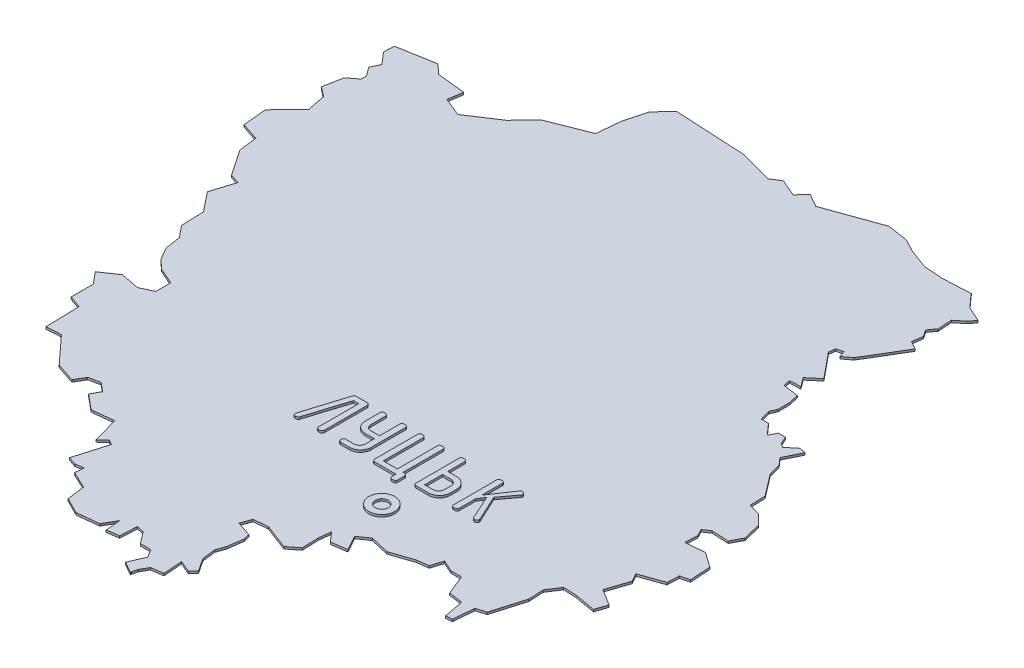
from build123d import *

# Parameters (mm, degrees)
EXTRUDE_1_DEPTH = 5
SKETCH_2_R      = 30
SKETCH_2_R_2    = 15
EXTRUDE_2_DEPTH = 10
SCALE_1_SCALE   = 0.05


with BuildPart() as part:
    # Эскиз1 → Бобышка-Вытянуть1 (new body)
    with BuildSketch(Plane(origin=(0, 0, 0), x_dir=(1, 0, 0), z_dir=(0, 1, 0))):
        Polygon((-8445.9445, 8921.74746), (-8480.32594, 8945.76316), (-8524.46352, 8941.86934), (-8523.14272, 8971.06918), (-8531.57806, 8986.65462), (-8516.00278, 8997.0229), (-8477.0976, 8995.07218), (-8463.45272, 9020.3909), (-8473.186, 9061.28744), (-8497.19916, 9085.29044), (-8523.14272, 9092.41768), (-8524.46352, 9128.125), (-8562.0733, 9177.43148), (-8570.53404, 9206.64148), (-8584.15352, 9222.19644), (-8565.3499, 9261.15242), (-8579.60438, 9264.40108), (-8601.66682, 9246.2223), (-8611.41534, 9252.70946), (-8618.55274, 9269.5776), (-8635.41834, 9269.5776), (-8643.85876, 9252.70946), (-8666.57652, 9278.01548), (-8683.43196, 9278.01548), (-8683.43196, 9278.65302), (-8689.92928, 9302.0261), (-8683.43196, 9316.97146), (-8683.43196, 9342.27748), (-8688.63896, 9366.92818), (-8724.32342, 9372.12502), (-8727.57208, 9387.68252), (-8702.26098, 9388.983), (-8717.8388, 9409.76274), (-8691.88254, 9431.82518), (-8739.91394, 9490.22232), (-8737.95814, 9505.13974), (-8722.3727, 9509.03102), (-8717.8388, 9494.75622), (-8699.0047, 9509.03102), (-8683.43196, 9534.36244), (-8645.80948, 9597.3011), (-8664.6258, 9607.677), (-8661.36444, 9631.68508), (-8671.76066, 9647.26544), (-8659.42134, 9664.12596), (-8661.36444, 9696.57446), (-8640.62026, 9713.4553), (-8630.21388, 9727.08748), (-8664.6258, 9742.66784), (-8683.43196, 9763.4425), (-8691.88254, 9773.16054), (-8756.75414, 9769.91442), (-8799.59124, 9773.16054), (-8845.6643, 9790.01852), (-8874.2266, 9805.60142), (-8922.24022, 9812.74644), (-9046.84754, 9767.96116), (-9077.34786, 9785.49732), (-9096.16672, 9764.73028), (-9135.74754, 9781.60858), (-9157.80998, 9767.96116), (-9234.38844, 9788.72058), (-9299.28798, 9791.96924), (-9398.56896, 9797.16608), (-9429.0769, 9764.73028), (-9442.68622, 9713.4553), (-9447.88052, 9658.94182), (-9538.7287, 9623.25736), (-9577.68722, 9582.37606), (-9645.82526, 9537.5857), (-9688.64966, 9555.11932), (-9683.44774, 9588.8556), (-9748.33712, 9596.00062), (-9770.40718, 9616.11996), (-9856.07376, 9601.17968), (-9857.35646, 9577.17414), (-9834.01894, 9549.92756), (-9843.73444, 9529.15798), (-9828.80686, 9509.03102), (-9828.80686, 9496.71456), (-9850.87184, 9479.84134), (-9859.31226, 9435.06368), (-9837.2422, 9418.18284), (-9828.80686, 9375.36606), (-9878.12858, 9324.09616), (-9872.93936, 9269.5776), (-9832.0606, 9255.97082), (-9826.86376, 9213.7738), (-9785.985, 9153.41578), (-9763.92002, 9146.93624), (-9780.78054, 9092.41768), (-9745.08592, 9047.65018), (-9743.16822, 8995.07218), (-9721.088, 8967.82306), (-9715.89116, 8932.12844), (-9699.03064, 8902.93368), (-9678.24582, 8884.1199), (-9640.6081, 8867.24922), (-9640.6081, 8832.8373), (-9669.82572, 8819.22798), (-9712.64758, 8827.66078), (-9750.28784, 8802.34714), (-9727.58024, 8775.10564), (-9727.58024, 8723.83066), (-9699.03064, 8713.44968), (-9697.0723, 8634.9205), (-9663.31824, 8636.87376), (-9604.92364, 8573.2747), (-9560.80638, 8558.34966), (-9547.17166, 8581.71512), (-9521.2281, 8586.90688), (-9501.10114, 8570.03366), (-9512.78006, 8549.2717), (-9478.39354, 8520.71194), (-9429.0769, 8525.9037), (-9412.19098, 8466.19846), (-9396.63856, 8481.1235), (-9384.93424, 8474.62872), (-9407.00684, 8399.35836), (-9388.18798, 8392.87882), (-9369.3742, 8396.11224), (-9371.30968, 8375.3452), (-9331.7314, 8356.53142), (-9326.54218, 8315.63742), (-9289.55216, 8296.82364), (-9239.57004, 8302.00524), (-9222.71714, 8331.22794), (-9219.46848, 8296.82364), (-9192.18888, 8300.72762), (-9190.26356, 8339.66074), (-9173.39796, 8336.41716), (-9152.62076, 8309.16042), (-9128.5949, 8309.16042), (-9116.91852, 8290.33902), (-9132.49888, 8254.64186), (-9105.24214, 8239.07928), (-9106.54516, 8242.30508), (-9103.3092, 8254.64186), (-9092.91044, 8272.81556), (-9065.66132, 8276.7297), (-9068.90236, 8320.84442), (-9041.6507, 8309.16042), (-9029.98448, 8320.84442), (-9050.09366, 8351.3295), (-9053.97478, 8382.48514), (-9046.84754, 8402.60956), (-9041.6507, 8438.94426), (-9044.89682, 8452.5739), (-9079.31128, 8464.2706), (-9070.85562, 8488.25836), (-9038.39442, 8491.5121), (-8980.65006, 8469.4395), (-8956.63944, 8488.25836), (-8957.9323, 8527.20926), (-8954.70142, 8554.44314), (-8935.88256, 8532.40356), (-8900.18032, 8537.57754), (-8919.0068, 8571.97168), (-8895.0038, 8588.84236), (-8850.86622, 8578.47154), (-8799.59124, 8595.97468), (-8773.6426, 8599.24366), (-8765.20472, 8626.49024), (-8737.95814, 8614.14838), (-8713.95514, 8614.14838), (-8695.11596, 8568.08294), (-8683.43196, 8566.77738), (-8662.67254, 8563.54142), (-8654.24228, 8517.46836), (-8639.30962, 8518.74598), (-8635.41834, 8566.77738), (-8613.36352, 8573.2747), (-8591.28584, 8648.54252), (-8593.2391, 8682.94174), (-8574.42278, 8711.50404), (-8543.26714, 8710.20356), (-8495.90122, 8701.75552), (-8486.80548, 8729.01734), (-8524.46352, 8752.39042), (-8507.5649, 8803.65016), (-8517.95858, 8822.46394), (-8464.74812, 8841.29804), (-8463.45272, 8868.54716), (-8442.6679, 8873.72876), align=None)
    extrude(amount=EXTRUDE_1_DEPTH)

    # Эскиз2 → Бобышка-Вытянуть2 (add)
    # profile 1 of 6: a face of its own
    with BuildSketch(Plane(origin=(0, 0, 0), x_dir=(1, 0, 0), z_dir=(0, 1, 0))):
        with Locations((-8947.382459031, 8663.207323909)):
            Circle(SKETCH_2_R)
        with Locations((-8947.382459031, 8663.207323909)):
            Circle(SKETCH_2_R_2, mode=Mode.SUBTRACT)
    # profile 2 of 6: a face of its own
    with BuildSketch(Plane(origin=(0, 0, 0), x_dir=(1, 0, 0), z_dir=(0, 1, 0))):
        with BuildLine():
            add(Edge.make_bspline(
                [(-9162.031707818, 8744.800393808), (-9162.050148959, 8744.379139303), (-9162.085042945, 8743.582049337), (-9162.453771217, 8742.468414247), (-9163.03611796, 8741.5125995), (-9163.890705395, 8740.749782095), (-9164.965300914, 8740.168972751), (-9166.263290394, 8739.752504184), (-9167.792728594, 8739.539932487), (-9168.882904747, 8739.501858681), (-9169.46414025, 8739.481559349)],
                knots=[0, 0, 0, 0, 0.969647621, 1.834749252, 2.678145047, 3.526077294, 4.446504318, 5.481227067, 6.657097526, 8, 8, 8, 8], degree=3))
            add(Edge.make_bspline(
                [(-9169.46414025, 8739.481559349), (-9169.929430469, 8739.501806181), (-9170.804451588, 8739.539882216), (-9172.035815546, 8739.755540855), (-9173.081039892, 8740.176474525), (-9173.935168743, 8740.766689771), (-9174.62269588, 8741.511510696), (-9175.082803542, 8742.44618575), (-9175.365586665, 8743.537489969), (-9175.394711986, 8744.31846573), (-9175.410086196, 8744.730714754)],
                knots=[0, 0, 0, 0, 1.231142298, 2.315276502, 3.288579949, 4.185921389, 5.041168779, 5.938510218, 6.911813665, 8, 8, 8, 8], degree=3))
            Line((-9175.410086196, 8744.730714754), (-9175.410086196, 8837.589667457))
            Line((-9175.410086196, 8837.589667457), (-9187.720052413, 8837.589667457))
            Line((-9187.720052413, 8837.589667457), (-9217.40332944, 8743.221001916))
            add(Edge.make_bspline(
                [(-9217.40332944, 8743.221001916), (-9217.640947251, 8742.651770625), (-9218.111711355, 8741.524019904), (-9219.583751986, 8740.280519546), (-9221.533325363, 8739.579366321), (-9222.978668222, 8739.516088313), (-9223.76734971, 8739.481559349)],
                knots=[0, 0, 0, 0, 0.920783868, 1.824240315, 2.812751332, 4, 4, 4, 4], degree=3))
            add(Edge.make_bspline(
                [(-9223.76734971, 8739.481559349), (-9224.201421995, 8739.502463355), (-9225.022151209, 8739.541987944), (-9226.181245882, 8739.751657712), (-9227.149614559, 8740.188266956), (-9227.980590263, 8740.742075189), (-9228.591074842, 8741.522197923), (-9229.037324609, 8742.43942666), (-9229.292567888, 8743.52523448), (-9229.324573274, 8744.295779426), (-9229.341674034, 8744.707488403)],
                knots=[0, 0, 0, 0, 1.192508042, 2.254753928, 3.205852217, 4.08983164, 4.9656069, 5.887070154, 6.871042903, 8, 8, 8, 8], degree=3))
            add(Edge.make_bspline(
                [(-9229.341674034, 8744.707488403), (-9229.318122429, 8744.995146056), (-9229.270614579, 8745.575403588), (-9229.132568664, 8746.141020954), (-9229.062957818, 8746.426238403)],
                knots=[0, 0, 0, 0, 0.991482704, 2, 2, 2, 2], degree=3))
            Line((-9229.062957818, 8746.426238403), (-9198.218363223, 8845.742116781))
            add(Edge.make_bspline(
                [(-9198.218363223, 8845.742116781), (-9197.997563748, 8846.303521975), (-9197.576943612, 8847.37299158), (-9196.400807864, 8848.636569884), (-9194.836577885, 8849.371283419), (-9193.689493224, 8849.443515637), (-9193.085339575, 8849.481559349)],
                knots=[0, 0, 0, 0, 1.049874067, 1.999996468, 2.94662576, 4, 4, 4, 4], degree=3))
            Line((-9193.085339575, 8849.481559349), (-9169.46414025, 8849.481559349))
            add(Edge.make_bspline(
                [(-9169.46414025, 8849.481559349), (-9168.882904747, 8849.461260016), (-9167.792728594, 8849.42318621), (-9166.263290394, 8849.210614514), (-9164.965300914, 8848.794145947), (-9163.890705395, 8848.213336602), (-9163.03611796, 8847.450519197), (-9162.453771217, 8846.49470445), (-9162.085042945, 8845.38106936), (-9162.050148959, 8844.583979395), (-9162.031707818, 8844.162724889)],
                knots=[0, 0, 0, 0, 1.342902474, 2.518772933, 3.553495682, 4.473922706, 5.321854953, 6.165250748, 7.030352379, 8, 8, 8, 8], degree=3))
            Line((-9162.031707818, 8844.162724889), (-9162.031707818, 8744.800393808))
        make_face()
    # profile 3 of 6: a face of its own
    with BuildSketch(Plane(origin=(0, 0, 0), x_dir=(1, 0, 0), z_dir=(0, 1, 0))):
        with BuildLine():
            Line((-9086.815491602, 8785.56264043), (-9108.415998359, 8785.56264043))
            add(Edge.make_bspline(
                [(-9108.415998359, 8785.56264043), (-9109.253045587, 8785.586710354), (-9110.902538591, 8785.63414277), (-9113.325231376, 8785.956367431), (-9115.64578579, 8786.529108595), (-9117.880084217, 8787.282219732), (-9120.01109935, 8788.294673179), (-9122.035595476, 8789.534278929), (-9123.968836697, 8790.983358929), (-9125.800653667, 8792.619280103), (-9127.444718771, 8794.435238654), (-9128.908302053, 8796.356753278), (-9130.136406915, 8798.373598671), (-9131.147736172, 8800.490209495), (-9131.941081251, 8802.698695215), (-9132.494988745, 8805.003994481), (-9132.827760916, 8807.401182516), (-9132.873334568, 8809.027924362), (-9132.896572683, 8809.857403943)],
                knots=[0, 0, 0, 0, 1.046542739, 2.062326793, 3.048388737, 4.031023869, 5.005279697, 5.991389151, 6.9942227, 8.022384199, 9.057041184, 10.052136522, 11.038245977, 12.003758709, 12.980463927, 13.966525871, 14.96312665, 16, 16, 16, 16], degree=3))
            Line((-9132.896572683, 8809.857403943), (-9132.896572683, 8844.185951241))
            add(Edge.make_bspline(
                [(-9132.896572683, 8844.185951241), (-9132.880139887, 8844.597853596), (-9132.848709787, 8845.385676454), (-9132.575427936, 8846.488501555), (-9132.101491822, 8847.429359356), (-9131.43059663, 8848.196698245), (-9130.566299586, 8848.785584329), (-9129.522681964, 8849.20790607), (-9128.290823093, 8849.423137148), (-9127.41587704, 8849.461278032), (-9126.950626737, 8849.481559349)],
                knots=[0, 0, 0, 0, 1.083429305, 2.072215321, 2.965634013, 3.832377457, 4.725796149, 5.694844779, 6.774239667, 8, 8, 8, 8], degree=3))
            add(Edge.make_bspline(
                [(-9126.950626737, 8849.481559349), (-9126.368442626, 8849.475321449), (-9125.274933797, 8849.463604882), (-9123.757653899, 8849.193881936), (-9122.446157663, 8848.826236292), (-9121.385864059, 8848.232806787), (-9120.523098179, 8847.50037127), (-9119.940822785, 8846.565095185), (-9119.571253711, 8845.474684655), (-9119.536547433, 8844.692490835), (-9119.518194304, 8844.278856646)],
                knots=[0, 0, 0, 0, 1.353106154, 2.541521659, 3.579288285, 4.507284885, 5.350131461, 6.185231121, 7.040326791, 8, 8, 8, 8], degree=3))
            Line((-9119.518194304, 8844.278856646), (-9119.518194304, 8810.786457997))
            add(Edge.make_bspline(
                [(-9119.518194304, 8810.786457997), (-9119.47770482, 8809.837082242), (-9119.399501558, 8808.00341401), (-9118.68205009, 8805.405920903), (-9117.52331233, 8803.083786596), (-9115.915036481, 8801.108668366), (-9114.044086515, 8799.497149137), (-9112.005918916, 8798.3364877), (-9109.869075148, 8797.583358106), (-9108.391076428, 8797.497572855), (-9107.649528764, 8797.454532322)],
                knots=[0, 0, 0, 0, 1.148644306, 2.218544726, 3.238301574, 4.272931153, 5.284625871, 6.213417378, 7.103628338, 8, 8, 8, 8], degree=3))
            Line((-9107.649528764, 8797.454532322), (-9086.815491602, 8797.454532322))
            Line((-9086.815491602, 8797.454532322), (-9086.815491602, 8844.278856646))
            add(Edge.make_bspline(
                [(-9086.815491602, 8844.278856646), (-9086.801082621, 8844.691360105), (-9086.774047989, 8845.465313494), (-9086.483388756, 8846.546417881), (-9086.028660107, 8847.475516035), (-9085.339722309, 8848.217482569), (-9084.491919424, 8848.816987618), (-9083.432202647, 8849.192261344), (-9082.214917036, 8849.463015923), (-9081.33592088, 8849.475131239), (-9080.869545656, 8849.481559349)],
                knots=[0, 0, 0, 0, 1.091529518, 2.047965782, 2.948064081, 3.805939007, 4.706037306, 5.674741692, 6.76627121, 8, 8, 8, 8], degree=3))
            add(Edge.make_bspline(
                [(-9080.869545656, 8849.481559349), (-9080.288310153, 8849.461260016), (-9079.198134, 8849.42318621), (-9077.668695799, 8849.210614514), (-9076.370706319, 8848.794145947), (-9075.2961108, 8848.213336602), (-9074.441523365, 8847.450519197), (-9073.859176622, 8846.49470445), (-9073.490448351, 8845.38106936), (-9073.455554365, 8844.583979395), (-9073.437113223, 8844.162724889)],
                knots=[0, 0, 0, 0, 1.342902474, 2.518772933, 3.553495682, 4.473922706, 5.321854953, 6.165250748, 7.030352379, 8, 8, 8, 8], degree=3))
            Line((-9073.437113223, 8844.162724889), (-9073.437113223, 8763.892454619))
            add(Edge.make_bspline(
                [(-9073.437113223, 8763.892454619), (-9073.45884874, 8763.093698155), (-9073.501897684, 8761.511696538), (-9073.863799082, 8759.176924112), (-9074.438532146, 8756.917453725), (-9075.26687873, 8754.733535937), (-9076.312742461, 8752.628259506), (-9077.567337772, 8750.582232299), (-9079.107472752, 8748.65385111), (-9080.819091471, 8746.793643333), (-9082.708503829, 8745.080112751), (-9084.749938242, 8743.5833336), (-9086.903609099, 8742.294108042), (-9089.205351525, 8741.281694706), (-9091.599604363, 8740.44797429), (-9094.128941528, 8739.911694731), (-9096.768677992, 8739.541701248), (-9098.574407328, 8739.501897724), (-9099.49707944, 8739.481559349)],
                knots=[0, 0, 0, 0, 0.964905936, 1.911074051, 2.848363436, 3.778149884, 4.728058265, 5.686180386, 6.672623048, 7.705544358, 8.739058838, 9.749658205, 10.760647355, 11.765817439, 12.783711154, 13.818918533, 14.885534502, 16, 16, 16, 16], degree=3))
            Line((-9099.49707944, 8739.481559349), (-9118.658819304, 8739.481559349))
            add(Edge.make_bspline(
                [(-9118.658819304, 8739.481559349), (-9119.078960149, 8739.496064109), (-9119.867965731, 8739.523303395), (-9120.972490333, 8739.813317491), (-9121.921641625, 8740.268922831), (-9122.692401452, 8740.948379043), (-9123.28179448, 8741.811582861), (-9123.703964643, 8742.855527362), (-9123.919242411, 8744.087285546), (-9123.957376213, 8744.962246871), (-9123.977653764, 8745.427505295)],
                knots=[0, 0, 0, 0, 1.101172267, 2.067951921, 2.977421716, 3.842135725, 4.733462525, 5.700242178, 6.77710972, 8, 8, 8, 8], degree=3))
            add(Edge.make_bspline(
                [(-9123.977653764, 8745.427505295), (-9123.957169342, 8745.892612398), (-9123.918646501, 8746.767289151), (-9123.705933708, 8748.000923545), (-9123.277114589, 8749.034731178), (-9122.718925006, 8749.915079393), (-9121.950956118, 8750.570156312), (-9121.03342954, 8751.053906378), (-9119.951372238, 8751.325255125), (-9119.179007414, 8751.35689769), (-9118.774951061, 8751.373451241)],
                knots=[0, 0, 0, 0, 1.236521053, 2.325391746, 3.302947472, 4.192640581, 5.066993003, 5.950007355, 6.927563081, 8, 8, 8, 8], degree=3))
            Line((-9118.774951061, 8751.373451241), (-9100.240322683, 8751.373451241))
            add(Edge.make_bspline(
                [(-9100.240322683, 8751.373451241), (-9099.345133141, 8751.423754707), (-9097.594156073, 8751.522147518), (-9095.062893032, 8752.266437914), (-9092.76214916, 8753.52874639), (-9090.698369301, 8755.217231513), (-9089.004858345, 8757.269417977), (-9087.698512566, 8759.549442369), (-9086.96657842, 8762.083672172), (-9086.86660378, 8763.833831696), (-9086.815491602, 8764.728603268)],
                knots=[0, 0, 0, 0, 1.020971316, 1.997004296, 2.981641766, 3.998934447, 5.021854658, 6.002995704, 6.979028684, 8, 8, 8, 8], degree=3))
            Line((-9086.815491602, 8764.728603268), (-9086.815491602, 8785.56264043))
        make_face()
    # profile 4 of 6: a face of its own
    with BuildSketch(Plane(origin=(0, 0, 0), x_dir=(1, 0, 0), z_dir=(0, 1, 0))):
        with BuildLine():
            add(Edge.make_bspline(
                [(-8977.410086196, 8730.074887051), (-8977.430107986, 8729.646537034), (-8977.468361485, 8728.82813432), (-8977.819871335, 8727.68402128), (-8978.421776086, 8726.716268999), (-8979.26618201, 8725.933036986), (-8980.33718213, 8725.321322672), (-8981.644817872, 8724.919312067), (-8983.168156872, 8724.665526913), (-8984.260686819, 8724.633663493), (-8984.842518629, 8724.616694484)],
                knots=[0, 0, 0, 0, 0.978196174, 1.868935147, 2.704424746, 3.5564603, 4.476991117, 5.502014125, 6.669686219, 8, 8, 8, 8], degree=3))
            add(Edge.make_bspline(
                [(-8984.842518629, 8724.616694484), (-8985.307634353, 8724.637174756), (-8986.182327316, 8724.675689795), (-8987.41585483, 8724.888454032), (-8988.450008094, 8725.31710679), (-8989.329209812, 8725.875848212), (-8989.992970415, 8726.647104965), (-8990.458114681, 8727.573222146), (-8990.74649714, 8728.65671657), (-8990.773873474, 8729.430311259), (-8990.788464575, 8729.842623538)],
                knots=[0, 0, 0, 0, 1.233611578, 2.319920209, 3.295175793, 4.182775495, 5.055070607, 5.954211828, 6.90963111, 8, 8, 8, 8], degree=3))
            Line((-8990.788464575, 8729.842623538), (-8990.788464575, 8739.481559349))
            Line((-8990.788464575, 8739.481559349), (-9040.37672471, 8739.481559349))
            add(Edge.make_bspline(
                [(-9040.37672471, 8739.481559349), (-9040.803354742, 8739.50146957), (-9041.601738371, 8739.538729006), (-9042.727289556, 8739.757385689), (-9043.675811486, 8740.184414706), (-9044.468350618, 8740.768881268), (-9045.063804306, 8741.545828603), (-9045.487354729, 8742.482125033), (-9045.73559423, 8743.580079995), (-9045.770284659, 8744.365538804), (-9045.788464575, 8744.777167457)],
                knots=[0, 0, 0, 0, 1.181336006, 2.210719494, 3.150373057, 4.037264857, 4.907177332, 5.827337472, 6.861391407, 8, 8, 8, 8], degree=3))
            Line((-9045.788464575, 8744.777167457), (-9045.788464575, 8844.185951241))
            add(Edge.make_bspline(
                [(-9045.788464575, 8844.185951241), (-9045.772031779, 8844.597853596), (-9045.740601678, 8845.385676454), (-9045.467319828, 8846.488501555), (-9044.993383714, 8847.429359356), (-9044.322488522, 8848.196698245), (-9043.458191478, 8848.785584329), (-9042.414573856, 8849.20790607), (-9041.182714985, 8849.423137148), (-9040.307768932, 8849.461278032), (-9039.842518629, 8849.481559349)],
                knots=[0, 0, 0, 0, 1.083429305, 2.072215321, 2.965634013, 3.832377457, 4.725796149, 5.694844779, 6.774239667, 8, 8, 8, 8], degree=3))
            add(Edge.make_bspline(
                [(-9039.842518629, 8849.481559349), (-9039.261430968, 8849.46100251), (-9038.171532112, 8849.422445721), (-9036.640283833, 8849.21302674), (-9035.351520775, 8848.787798278), (-9034.261937152, 8848.240817206), (-9033.423678403, 8847.474519245), (-9032.825450281, 8846.538034789), (-9032.467172858, 8845.434058368), (-9032.42971124, 8844.645504314), (-9032.410086196, 8844.232403943)],
                knots=[0, 0, 0, 0, 1.349898262, 2.531894363, 3.572007453, 4.488635547, 5.340985057, 6.173587819, 7.043196157, 8, 8, 8, 8], degree=3))
            Line((-9032.410086196, 8844.232403943), (-9032.410086196, 8751.373451241))
            Line((-9032.410086196, 8751.373451241), (-8999.707383494, 8751.373451241))
            Line((-8999.707383494, 8751.373451241), (-8999.707383494, 8844.232403943))
            add(Edge.make_bspline(
                [(-8999.707383494, 8844.232403943), (-8999.691833369, 8844.644479522), (-8999.662374791, 8845.425126702), (-8999.381831772, 8846.518639591), (-8998.911535883, 8847.451062692), (-8998.248223728, 8848.222428782), (-8997.368898653, 8848.781140128), (-8996.334782577, 8849.209801953), (-8995.101243564, 8849.422563386), (-8994.226552344, 8849.46107885), (-8993.761437548, 8849.481559349)],
                knots=[0, 0, 0, 0, 1.087671966, 2.060515348, 2.957432629, 3.827570202, 4.712974511, 5.685817892, 6.769439643, 8, 8, 8, 8], degree=3))
            add(Edge.make_bspline(
                [(-8993.761437548, 8849.481559349), (-8993.180349887, 8849.46100251), (-8992.090451031, 8849.422445721), (-8990.559202752, 8849.21302674), (-8989.270439694, 8848.787798278), (-8988.180856071, 8848.240817206), (-8987.342597322, 8847.474519245), (-8986.7443692, 8846.538034789), (-8986.386091777, 8845.434058368), (-8986.348630159, 8844.645504314), (-8986.329005115, 8844.232403943)],
                knots=[0, 0, 0, 0, 1.349898262, 2.531894363, 3.572007453, 4.488635547, 5.340985057, 6.173587819, 7.043196157, 8, 8, 8, 8], degree=3))
            Line((-8986.329005115, 8844.232403943), (-8986.329005115, 8751.373451241))
            Line((-8986.329005115, 8751.373451241), (-8984.888971332, 8751.373451241))
            add(Edge.make_bspline(
                [(-8984.888971332, 8751.373451241), (-8984.307326921, 8751.355691966), (-8983.207511567, 8751.322111445), (-8981.674412117, 8751.075427773), (-8980.356541831, 8750.662085314), (-8979.269524684, 8750.06468009), (-8978.422186799, 8749.273135552), (-8977.81975501, 8748.306334364), (-8977.468394772, 8747.161951334), (-8977.430119423, 8746.343588052), (-8977.410086196, 8745.915258673)],
                knots=[0, 0, 0, 0, 1.324874151, 2.505167947, 3.525999654, 4.458082004, 5.306633599, 6.138706896, 7.025803653, 8, 8, 8, 8], degree=3))
            Line((-8977.410086196, 8745.915258673), (-8977.410086196, 8730.074887051))
        make_face()
    # profile 5 of 6: a face of its own
    with BuildSketch(Plane(origin=(0, 0, 0), x_dir=(1, 0, 0), z_dir=(0, 1, 0))):
        with BuildLine():
            add(Edge.make_bspline(
                [(-8890.301978088, 8764.403434349), (-8890.32452071, 8763.589441848), (-8890.369172351, 8761.977113798), (-8890.719626705, 8759.590968047), (-8891.340562792, 8757.288616149), (-8892.137887383, 8755.04128701), (-8893.229883174, 8752.896560953), (-8894.532405803, 8750.811774351), (-8896.098213064, 8748.827749712), (-8897.846858043, 8746.924123081), (-8899.79226261, 8745.201190614), (-8901.855167262, 8743.644673011), (-8904.073956679, 8742.376379831), (-8906.399061132, 8741.320340471), (-8908.843381003, 8740.470441388), (-8911.42522663, 8739.908099871), (-8914.12176648, 8739.543075162), (-8915.958112744, 8739.502358254), (-8916.896150386, 8739.481559349)],
                knots=[0, 0, 0, 0, 0.963633486, 1.908731712, 2.847047916, 3.78375066, 4.726667904, 5.690606565, 6.689985837, 7.714895885, 8.747199612, 9.762926321, 10.769218895, 11.7661145, 12.783659731, 13.826693924, 14.88983742, 16, 16, 16, 16], degree=3))
            Line((-8916.896150386, 8739.481559349), (-8944.349697683, 8739.481559349))
            add(Edge.make_bspline(
                [(-8944.349697683, 8739.481559349), (-8944.776334526, 8739.501466709), (-8945.574730901, 8739.538720793), (-8946.700198274, 8739.757412669), (-8947.648997892, 8740.184325086), (-8948.440580032, 8740.769193486), (-8949.043927134, 8741.550304755), (-8949.450399216, 8742.493572665), (-8949.71436443, 8743.594112354), (-8949.745055606, 8744.38059513), (-8949.761437548, 8744.800393808)],
                knots=[0, 0, 0, 0, 1.178388678, 2.205203945, 3.142513155, 4.02719224, 4.89493436, 5.832243571, 6.842922806, 8, 8, 8, 8], degree=3))
            Line((-8949.761437548, 8744.800393808), (-8949.761437548, 8844.162724889))
            add(Edge.make_bspline(
                [(-8949.761437548, 8844.162724889), (-8949.746932788, 8844.582865733), (-8949.719693501, 8845.371871315), (-8949.429679406, 8846.476395918), (-8948.974074065, 8847.42554721), (-8948.294617854, 8848.196307037), (-8947.431414035, 8848.785700065), (-8946.387469534, 8849.207870228), (-8945.15571135, 8849.423147995), (-8944.280750026, 8849.461281798), (-8943.815491602, 8849.481559349)],
                knots=[0, 0, 0, 0, 1.101172267, 2.067951921, 2.977421716, 3.842135725, 4.733462525, 5.700242178, 6.77710972, 8, 8, 8, 8], degree=3))
            add(Edge.make_bspline(
                [(-8943.815491602, 8849.481559349), (-8943.233307491, 8849.475321449), (-8942.139798662, 8849.463604882), (-8940.622518764, 8849.193881936), (-8939.311022528, 8848.826236292), (-8938.250728924, 8848.232806787), (-8937.387963044, 8847.50037127), (-8936.80568765, 8846.565095185), (-8936.436118576, 8845.474684655), (-8936.401412298, 8844.692490835), (-8936.383059169, 8844.278856646)],
                knots=[0, 0, 0, 0, 1.353106154, 2.541521659, 3.579288285, 4.507284885, 5.350131461, 6.185231121, 7.040326791, 8, 8, 8, 8], degree=3))
            Line((-8936.383059169, 8844.278856646), (-8936.383059169, 8804.886964754))
            Line((-8936.383059169, 8804.886964754), (-8916.361944304, 8804.886964754))
            add(Edge.make_bspline(
                [(-8916.361944304, 8804.886964754), (-8915.447414146, 8804.864761292), (-8913.650214884, 8804.821127909), (-8911.009297247, 8804.473833478), (-8908.496325114, 8803.855755459), (-8906.080336836, 8803.055692838), (-8903.808582311, 8801.97505102), (-8901.639852719, 8800.685397773), (-8899.598570048, 8799.152974953), (-8897.706926243, 8797.387460764), (-8895.99278661, 8795.482978696), (-8894.456453405, 8793.500238085), (-8893.186758755, 8791.430196219), (-8892.120470195, 8789.298572212), (-8891.30885898, 8787.084686446), (-8890.72762779, 8784.79690548), (-8890.367037109, 8782.438538414), (-8890.323805045, 8780.841220794), (-8890.301978088, 8780.034768808)],
                knots=[0, 0, 0, 0, 1.096850268, 2.155487685, 3.187140075, 4.197419692, 5.202821391, 6.198265597, 7.219836451, 8.258155485, 9.297055814, 10.290809041, 11.262444892, 12.205247722, 13.145485597, 14.084759807, 15.03303561, 16, 16, 16, 16], degree=3))
            Line((-8890.301978088, 8780.034768808), (-8890.301978088, 8764.403434349))
        make_face()
        with BuildLine():
            Line((-8903.680356467, 8764.77505597), (-8903.680356467, 8779.663147186))
            add(Edge.make_bspline(
                [(-8903.680356467, 8779.663147186), (-8903.729941799, 8780.543237966), (-8903.827885539, 8782.281642847), (-8904.593788867, 8784.778918462), (-8905.867817341, 8787.0724843), (-8907.595965515, 8789.096914094), (-8909.646993671, 8790.815499954), (-8911.945457661, 8792.105690675), (-8914.475271178, 8792.842872068), (-8916.217989184, 8792.943728151), (-8917.105187548, 8792.995072862)],
                knots=[0, 0, 0, 0, 1.005936902, 1.986983231, 2.958581705, 3.989798119, 5.015327389, 6.006721754, 6.985244203, 8, 8, 8, 8], degree=3))
            Line((-8917.105187548, 8792.995072862), (-8936.383059169, 8792.995072862))
            Line((-8936.383059169, 8792.995072862), (-8936.383059169, 8751.373451241))
            Line((-8936.383059169, 8751.373451241), (-8917.105187548, 8751.373451241))
            add(Edge.make_bspline(
                [(-8917.105187548, 8751.373451241), (-8916.209903855, 8751.423644914), (-8914.458742631, 8751.521822971), (-8911.928818067, 8752.267674227), (-8909.618579354, 8753.526365883), (-8907.571733004, 8755.24246377), (-8905.860844243, 8757.294660791), (-8904.56952983, 8759.591832819), (-8903.830328992, 8762.129465454), (-8903.731091683, 8763.880061319), (-8903.680356467, 8764.77505597)],
                knots=[0, 0, 0, 0, 1.019269311, 1.9936752, 2.976671234, 3.99788619, 5.019101147, 6.0063248, 6.980730689, 8, 8, 8, 8], degree=3))
        make_face(mode=Mode.SUBTRACT)
    # profile 6 of 6: a face of its own
    with BuildSketch(Plane(origin=(0, 0, 0), x_dir=(1, 0, 0), z_dir=(0, 1, 0))):
        with BuildLine():
            Line((-8849.274951061, 8782.218045835), (-8849.274951061, 8744.846846511))
            add(Edge.make_bspline(
                [(-8849.274951061, 8744.846846511), (-8849.294472813, 8744.425883366), (-8849.331754097, 8743.621957193), (-8849.69158679, 8742.49788173), (-8850.278965002, 8741.534441578), (-8851.140094458, 8740.776374916), (-8852.200900856, 8740.163076423), (-8853.50780986, 8739.7547657), (-8855.035580071, 8739.539238262), (-8856.126011753, 8739.501617263), (-8856.707383494, 8739.481559349)],
                knots=[0, 0, 0, 0, 0.966526808, 1.845805764, 2.686487088, 3.531690263, 4.457941251, 5.489333743, 6.661419661, 8, 8, 8, 8], degree=3))
            add(Edge.make_bspline(
                [(-8856.707383494, 8739.481559349), (-8857.172641918, 8739.5018369), (-8858.047603242, 8739.539970702), (-8859.279361426, 8739.75524847), (-8860.323305927, 8740.177418632), (-8861.186509746, 8740.766811661), (-8861.865965957, 8741.537571487), (-8862.321571298, 8742.486722779), (-8862.611585393, 8743.591247382), (-8862.638824679, 8744.380252964), (-8862.65332944, 8744.800393808)],
                knots=[0, 0, 0, 0, 1.22289028, 2.299757822, 3.266537475, 4.157864275, 5.022578284, 5.932048079, 6.898827733, 8, 8, 8, 8], degree=3))
            Line((-8862.65332944, 8744.800393808), (-8862.65332944, 8844.162724889))
            add(Edge.make_bspline(
                [(-8862.65332944, 8844.162724889), (-8862.638824679, 8844.582865733), (-8862.611585393, 8845.371871315), (-8862.321571298, 8846.476395918), (-8861.865965957, 8847.42554721), (-8861.186509746, 8848.196307037), (-8860.323305927, 8848.785700065), (-8859.279361426, 8849.207870228), (-8858.047603242, 8849.423147995), (-8857.172641918, 8849.461281798), (-8856.707383494, 8849.481559349)],
                knots=[0, 0, 0, 0, 1.101172267, 2.067951921, 2.977421716, 3.842135725, 4.733462525, 5.700242178, 6.77710972, 8, 8, 8, 8], degree=3))
            add(Edge.make_bspline(
                [(-8856.707383494, 8849.481559349), (-8856.126295833, 8849.46100251), (-8855.036396977, 8849.422445721), (-8853.505148698, 8849.21302674), (-8852.21638564, 8848.787798278), (-8851.126802017, 8848.240817206), (-8850.288543268, 8847.474519245), (-8849.690315146, 8846.538034789), (-8849.332037722, 8845.434058368), (-8849.294576105, 8844.645504314), (-8849.274951061, 8844.232403943)],
                knots=[0, 0, 0, 0, 1.349898262, 2.531894363, 3.572007453, 4.488635547, 5.340985057, 6.173587819, 7.043196157, 8, 8, 8, 8], degree=3))
            Line((-8849.274951061, 8844.232403943), (-8849.274951061, 8796.757741781))
            Line((-8849.274951061, 8796.757741781), (-8814.179934169, 8848.715089754))
            add(Edge.make_bspline(
                [(-8814.179934169, 8848.715089754), (-8813.907780527, 8849.054336119), (-8813.377883746, 8849.714865794), (-8812.359516892, 8850.45068674), (-8811.195029867, 8850.895949585), (-8810.374780041, 8850.943552688), (-8809.952738223, 8850.968045835)],
                knots=[0, 0, 0, 0, 1.043405265, 2.031562344, 2.987182952, 4, 4, 4, 4], degree=3))
            add(Edge.make_bspline(
                [(-8809.952738223, 8850.968045835), (-8809.455435082, 8850.946704931), (-8808.494037223, 8850.905448206), (-8807.118791797, 8850.560579016), (-8805.914743539, 8849.933777479), (-8804.878630887, 8849.133816042), (-8804.074479814, 8848.216532023), (-8803.441708609, 8847.326156784), (-8803.032809631, 8846.433423287), (-8802.984543301, 8845.823109333), (-8802.961606467, 8845.533079619)],
                knots=[0, 0, 0, 0, 1.232201872, 2.382120968, 3.480921289, 4.575185605, 5.608136879, 6.491925667, 7.283342016, 8, 8, 8, 8], degree=3))
            add(Edge.make_bspline(
                [(-8802.961606467, 8845.533079619), (-8803.013970586, 8845.079518646), (-8803.125745264, 8844.111362745), (-8803.685855648, 8843.310794291), (-8803.983565926, 8842.885275565)],
                knots=[0, 0, 0, 0, 0.936958546, 2, 2, 2, 2], degree=3))
            Line((-8803.983565926, 8842.885275565), (-8831.20484971, 8806.512809349))
            Line((-8831.20484971, 8806.512809349), (-8803.70484971, 8747.053349889))
            add(Edge.make_bspline(
                [(-8803.70484971, 8747.053349889), (-8803.51646195, 8746.618738421), (-8803.186838689, 8745.858295972), (-8803.094203699, 8745.036417055), (-8803.054511872, 8744.684262051)],
                knots=[0, 0, 0, 0, 1.143048942, 2, 2, 2, 2], degree=3))
            add(Edge.make_bspline(
                [(-8803.054511872, 8744.684262051), (-8803.076906932, 8744.279513528), (-8803.119915141, 8743.502221135), (-8803.442408571, 8742.415234184), (-8804.001551247, 8741.488189646), (-8804.782585163, 8740.730317361), (-8805.806373527, 8740.173096371), (-8807.020741069, 8739.753030147), (-8808.459184102, 8739.540582025), (-8809.479933566, 8739.502041796), (-8810.022417277, 8739.481559349)],
                knots=[0, 0, 0, 0, 0.980941784, 1.883832903, 2.71790772, 3.581067539, 4.489409537, 5.522692817, 6.683419545, 8, 8, 8, 8], degree=3))
            add(Edge.make_bspline(
                [(-8810.022417277, 8739.481559349), (-8810.533839464, 8739.547206518), (-8811.58706044, 8739.682400058), (-8812.963975302, 8740.781594876), (-8814.050808805, 8742.471783855), (-8814.536821873, 8743.848903185), (-8814.807045656, 8744.614582997)],
                knots=[0, 0, 0, 0, 0.811433687, 1.671063562, 2.705108864, 4, 4, 4, 4], degree=3))
            Line((-8814.807045656, 8744.614582997), (-8839.264393629, 8798.104870159))
            Line((-8839.264393629, 8798.104870159), (-8849.274951061, 8782.218045835))
        make_face()
    extrude(amount=EXTRUDE_2_DEPTH)


with BuildPart() as part_1:
    # Масштаб1: scaled about (-9162.527774653, 2.558776042, -9099.241979301)
    add(part.part.scale(SCALE_1_SCALE).moved(Location((-8704.40138592, 2.43083724, -8644.279880336))))


solid = part_1.part
